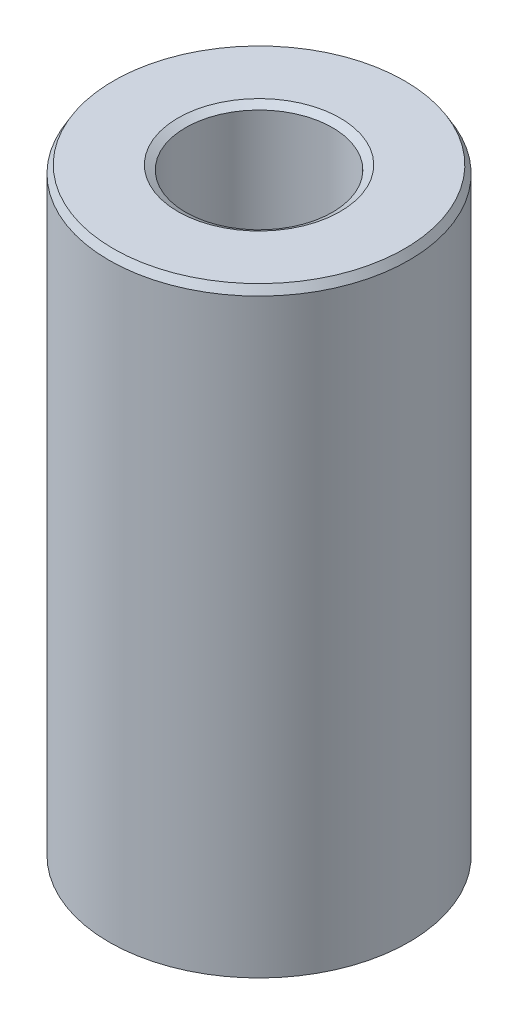
from build123d import *
from OCP.BRepFilletAPI import BRepFilletAPI_MakeChamfer

# Parameters (mm, degrees)
SKETCH1_R           = 45
BOSS_EXTRUDE1_DEPTH = 180.820248518
SKETCH2_R           = 22.026758548
CUT_EXTRUDE1_DEPTH  = 192.69236363
CHAMFER1_SIZE       = 2.311074993
CHAMFER1_SIZE2      = 1.334299769


with BuildPart() as part:
    # Sketch1 → Boss-Extrude1 (new body)
    with BuildSketch(Plane(origin=(0, 0, 0), x_dir=(1, 0, 0), z_dir=(0, 1, 0))):
        Circle(SKETCH1_R)
    extrude(amount=BOSS_EXTRUDE1_DEPTH)

    # Sketch2 → Cut-Extrude1 (cut, through all)
    with BuildSketch(Plane(origin=(0, 0, 0), x_dir=(1, 0, 0), z_dir=(0, 1, 0))):
        Circle(SKETCH2_R)
    extrude(amount=CUT_EXTRUDE1_DEPTH, mode=Mode.SUBTRACT)

    # Chamfer1: one chamfer whose edges measure the first distance from different faces: ONE call of the kernel's chamfer builder (chamfer() names one face for all edges)
    chamfer1_edges_1 = [part.edges().sort_by_distance(p)[0] for p in [
        (-22.026758548, 180.820248518, 0),
    ]]
    chamfer1_side_1 = [part.faces().sort_by_distance(p)[0] for p in [
        (-43.727207794, 180.820248518, 0),
    ]]
    chamfer1_edges_2 = [part.edges().sort_by_distance(p)[0] for p in [
        (-22.026758548, 0, 0),
    ]]
    chamfer1_side_2 = [part.faces().sort_by_distance(p)[0] for p in [
        (-22.026758548, 90.410124259, 0),
    ]]
    chamfer1_edges_3 = [part.edges().sort_by_distance(p)[0] for p in [
        (-45, 0, 0),
    ]]
    chamfer1_side_3 = [part.faces().sort_by_distance(p)[0] for p in [
        (-43.727207794, 0, 0),
    ]]
    chamfer1_edges_4 = [part.edges().sort_by_distance(p)[0] for p in [
        (-45, 180.820248518, 0),
    ]]
    chamfer1_side_4 = [part.faces().sort_by_distance(p)[0] for p in [
        (-45, 90.410124259, 0),
    ]]
    chamfer1 = BRepFilletAPI_MakeChamfer(part.part.solid().wrapped)
    for e in chamfer1_edges_1:
        chamfer1.Add(CHAMFER1_SIZE, CHAMFER1_SIZE2, e.wrapped, chamfer1_side_1[0].wrapped)  # the first distance lies on this face
    for e in chamfer1_edges_2:
        chamfer1.Add(CHAMFER1_SIZE, CHAMFER1_SIZE2, e.wrapped, chamfer1_side_2[0].wrapped)  # the first distance lies on this face
    for e in chamfer1_edges_3:
        chamfer1.Add(CHAMFER1_SIZE, CHAMFER1_SIZE2, e.wrapped, chamfer1_side_3[0].wrapped)  # the first distance lies on this face
    for e in chamfer1_edges_4:
        chamfer1.Add(CHAMFER1_SIZE, CHAMFER1_SIZE2, e.wrapped, chamfer1_side_4[0].wrapped)  # the first distance lies on this face
    add(Compound.cast(chamfer1.Shape()), mode=Mode.REPLACE)


solid = part.part
